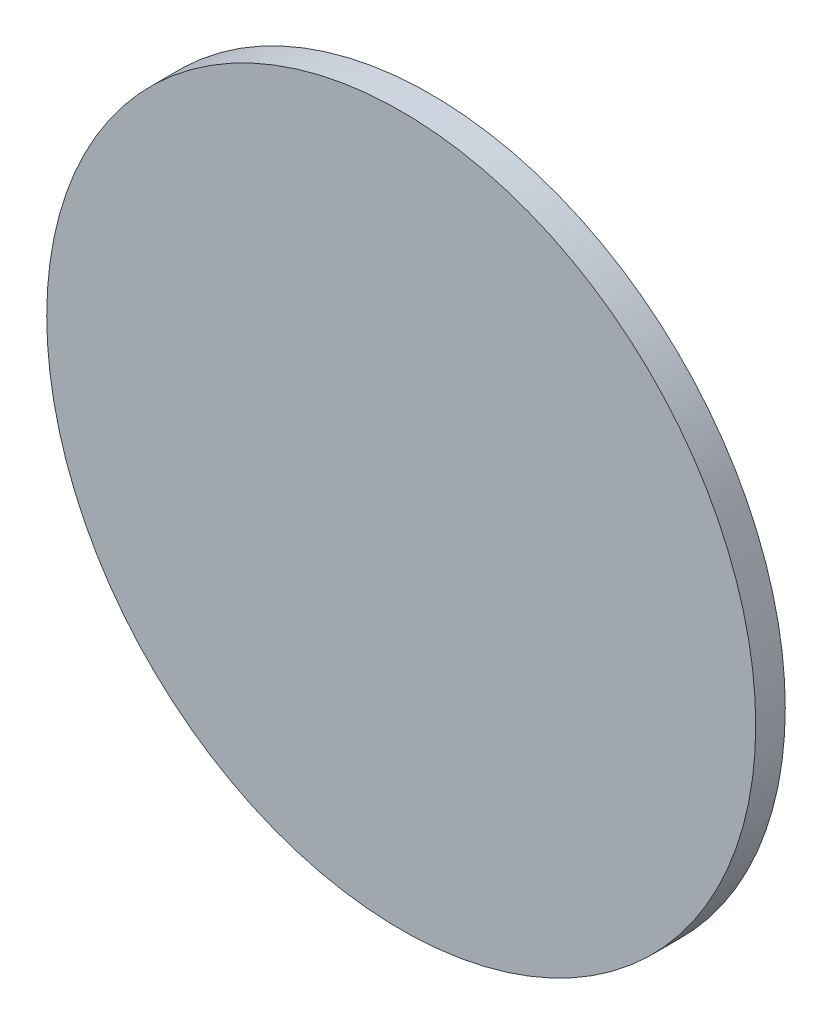
from build123d import *

# Parameters (mm, degrees)
SKETCH1_R           = 76.2
BOSS_EXTRUDE1_DEPTH = 6.35


with BuildPart() as part:
    # Sketch1 → Boss-Extrude1 (new body)
    with BuildSketch(Plane.XY):
        Circle(SKETCH1_R)
    extrude(amount=BOSS_EXTRUDE1_DEPTH)


solid = part.part
